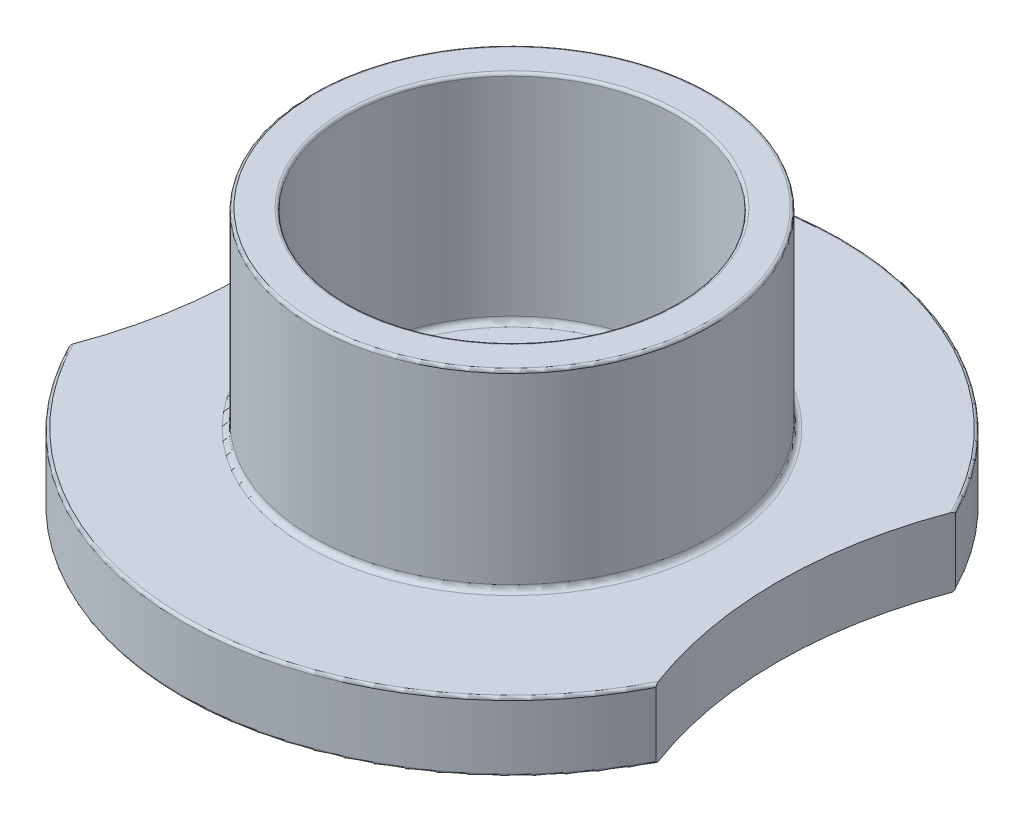
from build123d import *

# Parameters (mm, degrees)
ESBO_O2_R             = 75
CORTE_EXTRUS_O1_DEPTH = 97.382052271
FILETE1_R             = 0.5
FILETE2_R             = 1
FILETE3_R             = 1
CHANFRO1_SIZE         = 1
CHANFRO1_SIZE2        = 0.577350269
FILETE4_R             = 0.5
FILETE5_R             = 1
FILETE6_R             = 0.5
FILETE7_R             = 0.5


with BuildPart() as part:
    # Esboço1 → Revolução1 (revolve)
    with BuildSketch(Plane.XY, mode=Mode.PRIVATE) as revolu_o1_sk:
        Polygon((29.75, 23.582582583), (36, 23.582582583), (36, -10.917417417), (59.5, -10.917417417), (59.5, -23.417417417), (30.5, -23.417417417), (30.5, -32.417417417), (30, -32.417417417), (30, -41.417417417), (23, -41.417417417), (23, -15.417417417), (29.75, -15.417417417), align=None)
    revolve(revolu_o1_sk.sketch.rotate(Axis((0, -51.21951952, 0), (0, 1, 0)), 90), axis=Axis((0, -51.21951952, 0), (0, 1, 0)))

    # Esboço2 → Corte-extrusão1 (cut, through all)
    with BuildSketch(Plane.XZ.offset(23.417417417)):
        with Locations((122.992644904, 0)):
            Circle(ESBO_O2_R)
        with Locations((-122.992644904, 0)):
            Circle(ESBO_O2_R)
    extrude(amount=-CORTE_EXTRUS_O1_DEPTH, mode=Mode.SUBTRACT)

    # Filete1
    filete1_edges = [part.edges().sort_by_distance(p)[0] for p in [
        (0, 23.582582583, 36),
        (0, 23.582582583, 29.75),
    ]]
    fillet(filete1_edges, radius=FILETE1_R)

    # Filete2
    filete2_edges = [part.edges().sort_by_distance(p)[0] for p in [
        (0, -10.917417417, 36),
    ]]
    fillet(filete2_edges, radius=FILETE2_R)

    # Filete3
    filete3_edges = [part.edges().sort_by_distance(p)[0] for p in [
        (0, -15.417417417, 29.75),
    ]]
    fillet(filete3_edges, radius=FILETE3_R)

    # Chanfro1
    chanfro1_edges = [part.edges().sort_by_distance(p)[0] for p in [
        (0, -15.417417417, 23),
    ]]
    chanfro1_side = [part.faces().sort_by_distance(p)[0] for p in [
        (0, -15.417417417, 27.936827202),
    ]]
    chamfer(chanfro1_edges, length=CHANFRO1_SIZE, length2=CHANFRO1_SIZE2, reference=chanfro1_side[0])

    # Filete4
    filete4_edges = [part.edges().sort_by_distance(p)[0] for p in [
        (0, -41.417417417, 23),
        (0, -41.417417417, 30),
    ]]
    fillet(filete4_edges, radius=FILETE4_R)

    # Filete5
    filete5_edges = [part.edges().sort_by_distance(p)[0] for p in [
        (0, -23.417417417, 30.5),
    ]]
    fillet(filete5_edges, radius=FILETE5_R)

    # Filete6
    filete6_edges = [part.edges().sort_by_distance(p)[0] for p in [
        (0, -32.417417417, 30),
    ]]
    fillet(filete6_edges, radius=FILETE6_R - 0.0001)  # a hair under: the kernel refuses the full size

    # Filete7
    filete7_edges = [part.edges().sort_by_distance(p)[0] for p in [
        (0, -23.417417417, 59.5),
        (0, -10.917417417, 59.5),
        (0, -23.417417417, -59.5),
        (0, -10.917417417, -59.5),
    ]]
    fillet(filete7_edges, radius=FILETE7_R)


solid = part.part
